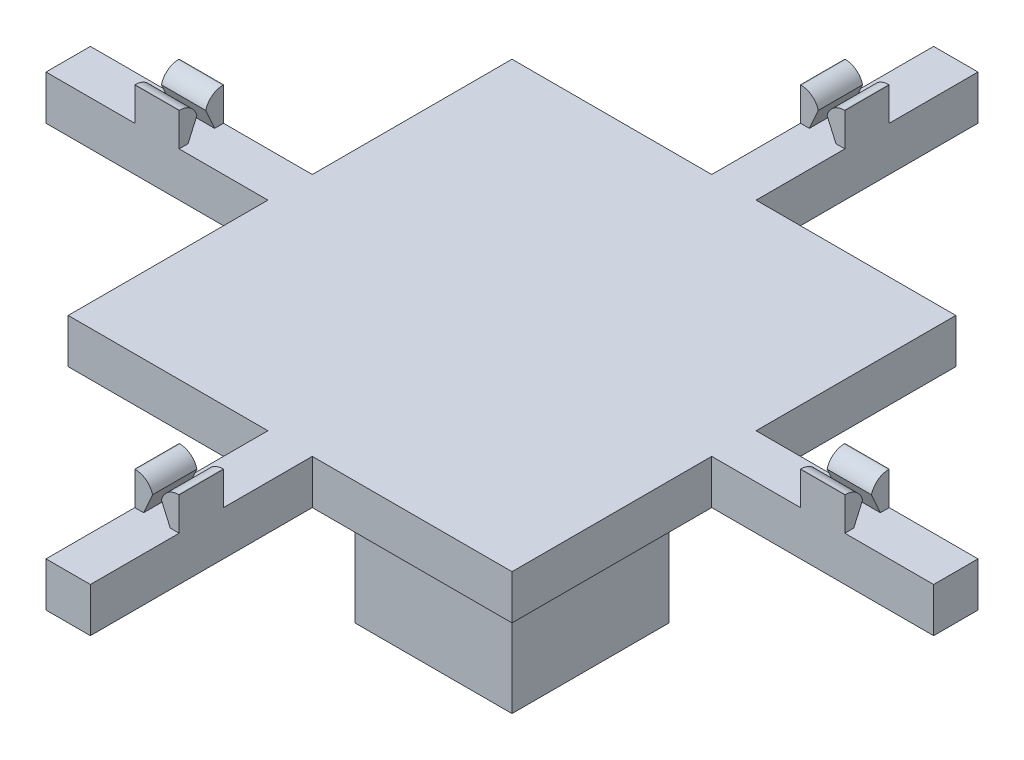
from build123d import *

# Parameters (mm, degrees)
SKETCH2_W            = 100
SKETCH2_H            = 100
BOSS_EXTRUDE1_DEPTH  = 5
SKETCH3_W            = 100
SKETCH3_H            = 100
BOSS_EXTRUDE2_DEPTH  = 5
SKETCH8_R            = 5
BOSS_EXTRUDE7_DEPTH  = 30
SKETCH9_W            = 35.4
SKETCH9_H            = 35.4
BOSS_EXTRUDE8_DEPTH  = 20
SKETCH10_W           = 25.4
SKETCH10_H           = 25.4
CUT_EXTRUDE1_DEPTH   = 12.7
SKETCH11_W           = 10
SKETCH11_H           = 10
BOSS_EXTRUDE9_DEPTH  = 20
BOSS_EXTRUDE13_DEPTH = 10
FILLET3_R            = 4
FILLET5_R            = 4
SKETCH16_W           = 10
SKETCH16_H           = 10
BOSS_EXTRUDE14_DEPTH = 20
SKETCH13_W           = 10
SKETCH13_H           = 10
BOSS_EXTRUDE11_DEPTH = 20
BOSS_EXTRUDE17_DEPTH = 10
FILLET9_R            = 4
FILLET10_R           = 4
SKETCH21_W           = 10
SKETCH21_H           = 10
BOSS_EXTRUDE18_DEPTH = 20
SKETCH14_W           = 10
SKETCH14_H           = 10
BOSS_EXTRUDE12_DEPTH = 20
BOSS_EXTRUDE15_DEPTH = 10
FILLET7_R            = 4
SKETCH18_W           = 10
SKETCH18_H           = 10
BOSS_EXTRUDE16_DEPTH = 20
FILLET8_R            = 4
SKETCH12_W           = 10
SKETCH12_H           = 10
BOSS_EXTRUDE10_DEPTH = 20
BOSS_EXTRUDE19_DEPTH = 10
FILLET11_R           = 4
FILLET12_R           = 4
SKETCH23_W           = 10
SKETCH23_H           = 10
BOSS_EXTRUDE20_DEPTH = 20


with BuildPart() as part:
    # Sketch2 → Boss-Extrude1 (new body)
    with BuildSketch(Plane(origin=(0, 0, 0), x_dir=(1, 0, 0), z_dir=(0, 1, 0))):
        Rectangle(SKETCH2_W, SKETCH2_H)
    extrude(amount=BOSS_EXTRUDE1_DEPTH)

    # Sketch3 → Boss-Extrude2 (add)
    with BuildSketch(Plane.XZ):
        Rectangle(SKETCH3_W, SKETCH3_H)
    extrude(amount=BOSS_EXTRUDE2_DEPTH)

    # Sketch8 → Boss-Extrude7 (add)
    with BuildSketch(Plane.XZ.offset(5)):
        with Locations(Location((0, 0, 0), (0, 0, 90))):
            Circle(SKETCH8_R)
    extrude(amount=BOSS_EXTRUDE7_DEPTH)

    # Sketch9 → Boss-Extrude8 (add)
    with BuildSketch(Plane.XZ.offset(35)):
        Rectangle(SKETCH9_W, SKETCH9_H)
    extrude(amount=BOSS_EXTRUDE8_DEPTH)

    # Sketch10 → Cut-Extrude1 (cut)
    with BuildSketch(Plane.XZ.offset(55)):
        Rectangle(SKETCH10_W, SKETCH10_H)
    extrude(amount=-CUT_EXTRUDE1_DEPTH, mode=Mode.SUBTRACT)

    # Sketch11 → Boss-Extrude9 (add)
    with BuildSketch(Plane(origin=(50, 0, 0), x_dir=(0, 0, -1), z_dir=(1, 0, 0))):
        Rectangle(SKETCH11_W, SKETCH11_H)
    extrude(amount=BOSS_EXTRUDE9_DEPTH)

    # Sketch15 → Boss-Extrude13 (add)
    with BuildSketch(Plane(origin=(70, 0, 0), x_dir=(0, 0, -1), z_dir=(1, 0, 0))):
        Polygon((-5, -5), (5, -5), (5, 12.5), (1, 12.5), (1, 9.5), (3, 5), (-3, 5), (-1, 9.5), (-1, 12.5), (-5, 12.5), align=None)
    extrude(amount=BOSS_EXTRUDE13_DEPTH)

    # Fillet3
    # the kernel refuses this fillet: 4 mm, written as the material it takes off along each edge
    with BuildSketch(Plane(origin=(60.317541634, 12.5, 1), x_dir=(0, -1, 0), z_dir=(1, 0, 0))) as fillet3_piece_1:
        with BuildLine():
            CenterArc((4, -3.872983346), FILLET3_R, 104.477512186, 75.522487814)
            Line((0, -3.872983346), (-0.08, -3.872983346))
            Line((-0.08, -3.872983346), (-0.08, 0))
            Line((-0.08, 0), (0, 0.08))
            ThreePointArc((0, 0.08), (1.5, 0.08), (2.98, 0.077459667))
            Line((2.98, 0.077459667), (3, 0))
        make_face()
    extrude(amount=29.364916731, mode=Mode.SUBTRACT)

    # Fillet5
    # the kernel refuses this fillet: 4 mm, written as the material it takes off along each edge
    with BuildSketch(Plane(origin=(60.317541634, 12.5, -1), x_dir=(0, 0, -1), z_dir=(1, 0, 0))) as fillet5_piece_1:
        with BuildLine():
            CenterArc((3.872983346, -4), FILLET5_R, 90, 75.522487814)
            Line((0, -3), (-0.077459667, -2.98))
            ThreePointArc((-0.077459667, -2.98), (-0.08, -1.5), (-0.08, 0))
            Line((-0.08, 0), (0, 0.08))
            Line((0, 0.08), (3.872983346, 0.08))
            Line((3.872983346, 0.08), (3.872983346, 0))
        make_face()
    extrude(amount=29.364916731, mode=Mode.SUBTRACT)

    # Sketch16 → Boss-Extrude14 (add)
    with BuildSketch(Plane(origin=(80, 0, 0), x_dir=(0, 0, -1), z_dir=(1, 0, 0))):
        Rectangle(SKETCH16_W, SKETCH16_H)
    extrude(amount=BOSS_EXTRUDE14_DEPTH)

    # Sketch13 → Boss-Extrude11 (add)
    with BuildSketch(Plane.ZY.offset(50)):
        Rectangle(SKETCH13_W, SKETCH13_H)
    extrude(amount=BOSS_EXTRUDE11_DEPTH)

    # Sketch19 → Boss-Extrude17 (add)
    with BuildSketch(Plane.ZY.offset(70)):
        Polygon((-5, -5), (5, -5), (5, 12.5), (1, 12.5), (1, 9.5), (3, 5), (-3, 5), (-1, 9.5), (-1, 12.499789013), (-5, 12.499789013), align=None)
    extrude(amount=BOSS_EXTRUDE17_DEPTH)

    # Fillet9
    # the kernel refuses this fillet: 4 mm, written as the material it takes off along each edge
    with BuildSketch(Plane(origin=(-60.317677841, 12.499789013, -1), x_dir=(0, -1, 0), z_dir=(-1, 0, 0))) as fillet9_piece_1:
        with BuildLine():
            CenterArc((4, -3.872928863), FILLET9_R, 104.480633491, 75.519366509)
            Line((0, -3.872928863), (-0.08, -3.872928863))
            Line((-0.08, -3.872928863), (-0.08, 0))
            Line((-0.08, 0), (0, 0.08))
            ThreePointArc((0, 0.08), (1.499894506, 0.08), (2.979784793, 0.077458577))
            Line((2.979784793, 0.077458577), (2.999789013, 0))
        make_face()
    extrude(amount=29.364644317, mode=Mode.SUBTRACT)

    # Fillet10
    # the kernel refuses this fillet: 4 mm, written as the material it takes off along each edge
    with BuildSketch(Plane(origin=(-60.317541634, 12.5, 1), x_dir=(0, 0, 1), z_dir=(-1, 0, 0))) as fillet10_piece_1:
        with BuildLine():
            CenterArc((3.872983346, -4), FILLET10_R, 90, 75.522487814)
            Line((0, -3), (-0.077459667, -2.98))
            ThreePointArc((-0.077459667, -2.98), (-0.08, -1.5), (-0.08, 0))
            Line((-0.08, 0), (0, 0.08))
            Line((0, 0.08), (3.872983346, 0.08))
            Line((3.872983346, 0.08), (3.872983346, 0))
        make_face()
    extrude(amount=29.364916731, mode=Mode.SUBTRACT)

    # Sketch21 → Boss-Extrude18 (add)
    with BuildSketch(Plane.ZY.offset(80)):
        Rectangle(SKETCH21_W, SKETCH21_H)
    extrude(amount=BOSS_EXTRUDE18_DEPTH)

    # Sketch14 → Boss-Extrude12 (add)
    with BuildSketch(Plane(origin=(0, 0, -50), x_dir=(-1, 0, 0), z_dir=(0, 0, -1))):
        Rectangle(SKETCH14_W, SKETCH14_H)
    extrude(amount=BOSS_EXTRUDE12_DEPTH)

    # Sketch17 → Boss-Extrude15 (add)
    with BuildSketch(Plane(origin=(0, 0, -70), x_dir=(-1, 0, 0), z_dir=(0, 0, -1))):
        Polygon((-5, -5), (5, -5), (5, 12.5), (1, 12.5), (1, 9.5), (3, 5), (-3, 5), (-1, 9.5), (-1, 12.5), (-5, 12.5), align=None)
    extrude(amount=BOSS_EXTRUDE15_DEPTH)

    # Fillet7
    # the kernel refuses this fillet: 4 mm, written as the material it takes off along each edge
    with BuildSketch(Plane(origin=(1, 12.5, -60.317541634), x_dir=(0, -1, 0), z_dir=(0, 0, -1))) as fillet7_piece_1:
        with BuildLine():
            CenterArc((4, -3.872983346), FILLET7_R, 104.477512186, 75.522487814)
            Line((0, -3.872983346), (-0.08, -3.872983346))
            Line((-0.08, -3.872983346), (-0.08, 0))
            Line((-0.08, 0), (0, 0.08))
            ThreePointArc((0, 0.08), (1.5, 0.08), (2.98, 0.077459667))
            Line((2.98, 0.077459667), (3, 0))
        make_face()
    extrude(amount=29.364916731, mode=Mode.SUBTRACT)

    # Sketch18 → Boss-Extrude16 (add)
    with BuildSketch(Plane(origin=(0, 0, -80), x_dir=(-1, 0, 0), z_dir=(0, 0, -1))):
        Rectangle(SKETCH18_W, SKETCH18_H)
    extrude(amount=BOSS_EXTRUDE16_DEPTH)

    # Fillet8
    # the kernel refuses this fillet: 4 mm, written as the material it takes off along each edge
    with BuildSketch(Plane(origin=(-1, 12.5, -60.317541634), x_dir=(-1, 0, 0), z_dir=(0, 0, -1))) as fillet8_piece_1:
        with BuildLine():
            CenterArc((3.872983346, -4), FILLET8_R, 90, 75.522487814)
            Line((0, -3), (-0.077459667, -2.98))
            ThreePointArc((-0.077459667, -2.98), (-0.08, -1.5), (-0.08, 0))
            Line((-0.08, 0), (0, 0.08))
            Line((0, 0.08), (3.872983346, 0.08))
            Line((3.872983346, 0.08), (3.872983346, 0))
        make_face()
    extrude(amount=29.364916731, mode=Mode.SUBTRACT)

    # Sketch12 → Boss-Extrude10 (add)
    with BuildSketch(Plane.XY.offset(50)):
        Rectangle(SKETCH12_W, SKETCH12_H)
    extrude(amount=BOSS_EXTRUDE10_DEPTH)

    # Sketch22 → Boss-Extrude19 (add)
    with BuildSketch(Plane.XY.offset(70)):
        Polygon((5, -5), (5, 12.5), (1, 12.5), (1, 9.5), (3, 5), (-3, 5), (-1, 9.5), (-1, 12.5), (-5, 12.5), (-5, -5), align=None)
    extrude(amount=BOSS_EXTRUDE19_DEPTH)

    # Fillet11
    # the kernel refuses this fillet: 4 mm, written as the material it takes off along each edge
    with BuildSketch(Plane(origin=(-1, 12.5, 60.317541634), x_dir=(0, -1, 0), z_dir=(0, 0, 1))) as fillet11_piece_1:
        with BuildLine():
            CenterArc((4, -3.872983346), FILLET11_R, 104.477512186, 75.522487814)
            Line((0, -3.872983346), (-0.08, -3.872983346))
            Line((-0.08, -3.872983346), (-0.08, 0))
            Line((-0.08, 0), (0, 0.08))
            ThreePointArc((0, 0.08), (1.5, 0.08), (2.98, 0.077459667))
            Line((2.98, 0.077459667), (3, 0))
        make_face()
    extrude(amount=29.364916731, mode=Mode.SUBTRACT)

    # Fillet12
    # the kernel refuses this fillet: 4 mm, written as the material it takes off along each edge
    with BuildSketch(Plane(origin=(1, 12.5, 60.317541634), x_dir=(1, 0, 0), z_dir=(0, 0, 1))) as fillet12_piece_1:
        with BuildLine():
            CenterArc((3.872983346, -4), FILLET12_R, 90, 75.522487814)
            Line((0, -3), (-0.077459667, -2.98))
            ThreePointArc((-0.077459667, -2.98), (-0.08, -1.5), (-0.08, 0))
            Line((-0.08, 0), (0, 0.08))
            Line((0, 0.08), (3.872983346, 0.08))
            Line((3.872983346, 0.08), (3.872983346, 0))
        make_face()
    extrude(amount=29.364916731, mode=Mode.SUBTRACT)

    # Sketch23 → Boss-Extrude20 (add)
    with BuildSketch(Plane.XY.offset(80)):
        Rectangle(SKETCH23_W, SKETCH23_H)
    extrude(amount=BOSS_EXTRUDE20_DEPTH)


solid = part.part
